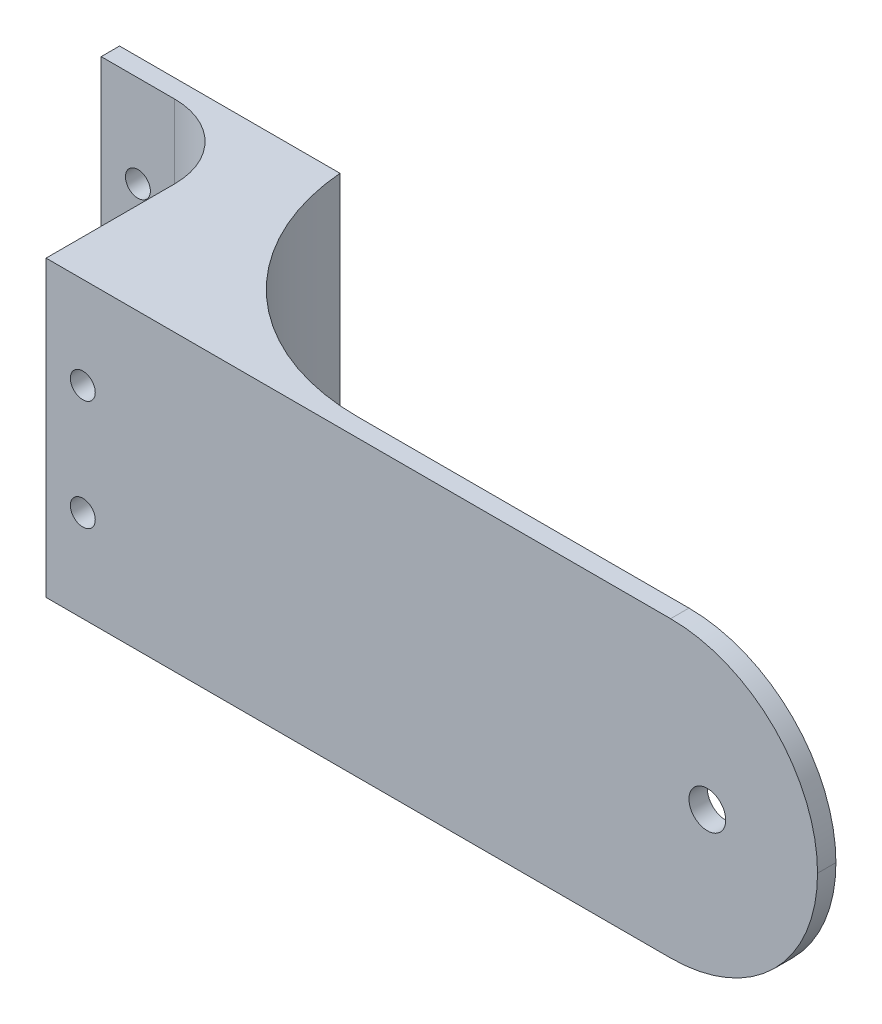
from build123d import *

# Parameters (mm, degrees)
BOSS_EXTRUDE1_DEPTH = 3.175
SKETCH2_W           = 12.7
SKETCH2_H           = 50.8
BOSS_EXTRUDE2_DEPTH = 31.75
FILLET1_R           = 12.7
BOSS_EXTRUDE3_DEPTH = 3.175
FILLET2_R           = 38.1
SKETCH4_R           = 2.15265
CUT_EXTRUDE1_DEPTH  = 38.1
FILLET3_R           = 25.4
CUT_EXTRUDE4_REACH  = 131.047
SKETCH7_R           = 3.175


# Some blends are built 0.0001 mm under size
with BuildPart() as part:
    # Sketch1 → Boss-Extrude1 (new body)
    with BuildSketch(Plane.XY.offset(15.875)):
        Polygon((-38.1, 25.4), (-38.1, -25.4), (-25.4, -25.4), (0, -25.4), (0, 25.4), align=None)
    extrude(amount=BOSS_EXTRUDE1_DEPTH)

    # Sketch2 → Boss-Extrude2 (add)
    with BuildSketch(Plane.XY.offset(50.8)):
        with Locations((-6.35, 0)):
            Rectangle(SKETCH2_W, SKETCH2_H)
    extrude(amount=-BOSS_EXTRUDE2_DEPTH)

    # Fillet1
    fillet1_edges = [part.edges().sort_by_distance(p)[0] for p in [
        (-12.7, 0, 19.05),
    ]]
    fillet(fillet1_edges, radius=FILLET1_R)

    # Sketch3 → Boss-Extrude3 (add)
    with BuildSketch(Plane.XY.offset(50.8)):
        Polygon((0, 25.4), (101.6, 25.4), (120.65, 25.4), (120.65, -25.4), (0, -25.4), (-12.7, -25.4), (-12.7, 25.4), align=None)
    extrude(amount=BOSS_EXTRUDE3_DEPTH)

    # Fillet2
    # the kernel refuses this fillet: 38.1 mm, written as the material it adds along each edge
    with BuildSketch(Plane(origin=(0, -25.4, 50.8), x_dir=(0, 0, -1), z_dir=(0, 1, 0))) as fillet2_piece_1:
        with BuildLine():
            CenterArc((38.1, -37.967477859), FILLET2_R, 94.780191847, 85.219808153)
            Line((0, -37.967477859), (-0.762, -37.967477859))
            Line((-0.762, -37.967477859), (-0.762, 0))
            Line((-0.762, 0), (0, 0.762))
            ThreePointArc((0, 0.762), (17.4625, 0.762), (34.8615, 0.759349557))
            Line((34.8615, 0.759349557), (34.925, 0))
        make_face()
    extrude(amount=50.8)

    # Sketch4 → Cut-Extrude1 (cut)
    with BuildSketch(Plane.XY.offset(53.975)):
        with Locations((-6.35, 9.525)):
            Circle(SKETCH4_R)
        with Locations((-31.75, 9.525)):
            Circle(SKETCH4_R)
        with Locations((-6.35, -9.525)):
            Circle(SKETCH4_R)
        with Locations((-31.75, -9.525)):
            Circle(SKETCH4_R)
    extrude(amount=-CUT_EXTRUDE1_DEPTH, mode=Mode.SUBTRACT)

    # Fillet3
    fillet3_edges = [part.edges().sort_by_distance(p)[0] for p in [
        (120.65, -25.4, 52.3875),
        (120.65, 25.4, 52.3875),
    ]]
    fillet(fillet3_edges, radius=FILLET3_R - 0.0001)  # a hair under: the kernel refuses the full size

    # Sketch7 → Cut-Extrude4 (cut, up to next)
    with BuildSketch(Plane.XY.offset(53.975), mode=Mode.PRIVATE) as cut_extrude4_sk1:
        with Locations((101.6, 0)):
            Circle(SKETCH7_R)
    cut_extrude4_tool1 = extrude(cut_extrude4_sk1.sketch, amount=-CUT_EXTRUDE4_REACH, mode=Mode.PRIVATE) & part.part
    add(cut_extrude4_tool1.solids().sort_by_distance((101.6, 0, 53.975))[0], mode=Mode.SUBTRACT)


solid = part.part
